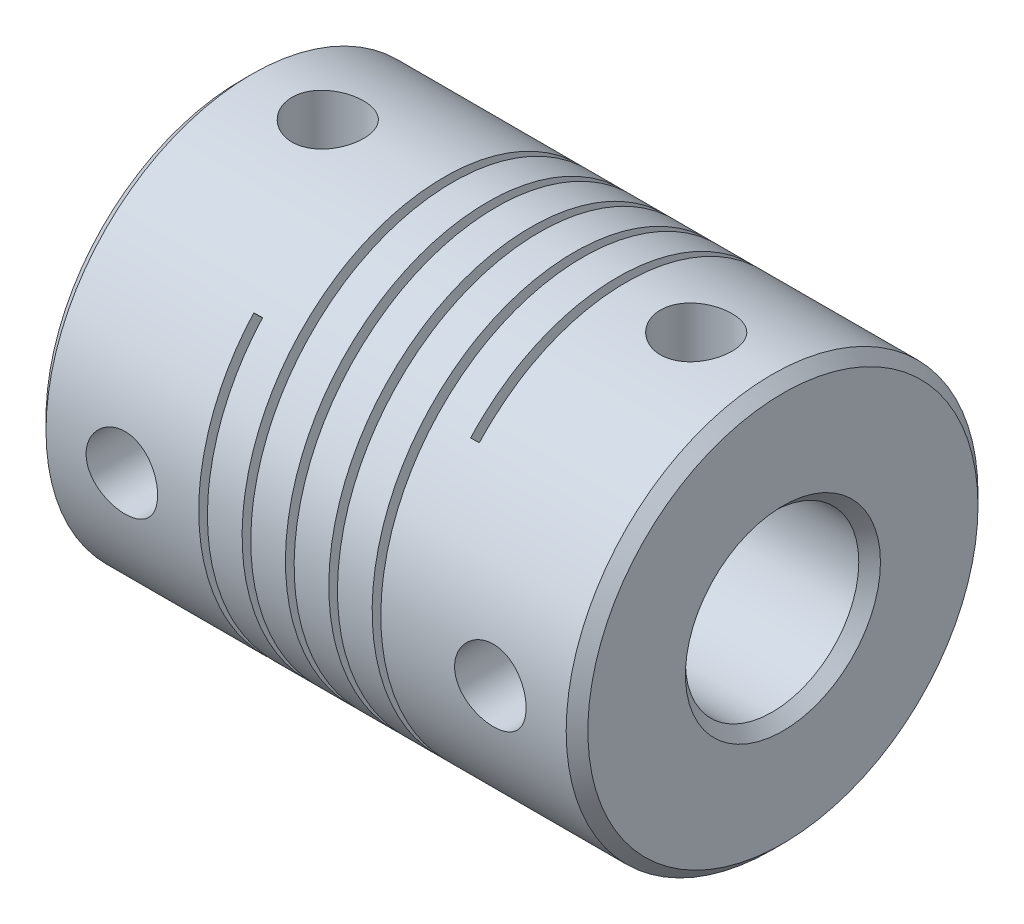
from build123d import *

# Parameters (mm, degrees)
SKETCH1_R                 = 9.5
BOSS_EXTRUDE1_DEPTH       = 25
SKETCH2_R                 = 2.5
CUT_EXTRUDE1_DEPTH        = 29.381331893
CUT_SWEEP1_PITCH          = 2
SKETCH7_R                 = 4
CUT_EXTRUDE2_DEPTH        = 12.5
SKETCH8_R                 = 1.65
CUT_EXTRUDE3_DEPTH        = 9
CIRPATTERN1_COUNT         = 2
CIRPATTERN1_ANGLE         = 90
LPATTERN1_COUNT           = 2
LPATTERN1_PITCH           = 17
LPATTERN1_COPY_1_SKETCH_R = 1.65
LPATTERN1_COPY_1_DEPTH    = 9
CHAMFER1_SIZE             = 0.5


with BuildPart() as part:
    # Sketch1 → Boss-Extrude1 (new body)
    with BuildSketch(Plane(origin=(0, 0, 0), x_dir=(0, 0, -1), z_dir=(1, 0, 0))):
        Circle(SKETCH1_R)
    extrude(amount=BOSS_EXTRUDE1_DEPTH)

    # Sketch2 → Cut-Extrude1 (cut, through all)
    with BuildSketch(Plane.ZY):
        Circle(SKETCH2_R)
    extrude(amount=-CUT_EXTRUDE1_DEPTH, mode=Mode.SUBTRACT)

    # Cut-Sweep1: the profile of Sketch6 profile screwed along a right-hand helix of 5 turns, 10 arcs to a turn; built about Z, then put on its axis
    cut_sweep1_z = Axis((0, 0, 0), (0, 0, 1))
    cut_sweep1_corners = [(9.5003, -0.000137108, 0.004092011), (9.500300002, -0.013532113, 0.403867665), (1.5, -0.013532113, 0.403867665), (1.5, -0.000137108, 0.004092011)]
    with BuildLine(mode=Mode.PRIVATE) as cut_sweep1_profile:
        Line(cut_sweep1_corners[0], cut_sweep1_corners[1])
        Line(cut_sweep1_corners[1], cut_sweep1_corners[2])
        Line(cut_sweep1_corners[2], cut_sweep1_corners[3])
        Line(cut_sweep1_corners[3], cut_sweep1_corners[0])
    cut_sweep1_cap = Face(cut_sweep1_profile.wire())
    cut_sweep1_turn_angles = [0, 18, 36, 54, 72, 90, 108, 126, 144, 162, 180, 198, 216, 234, 252, 270, 288, 306, 324, 342, 360]
    cut_sweep1_turn_weights = [1, 0.9510565162951535, 1, 0.9510565162951535, 1, 0.9510565162951535, 1, 0.9510565162951535, 1, 0.9510565162951535, 1, 0.9510565162951535, 1, 0.9510565162951535, 1, 0.9510565162951535, 1, 0.9510565162951535, 1, 0.9510565162951535, 1]
    cut_sweep1_turn_rails = [Edge.make_bspline([Vector(p[0], p[1], 0).rotate(cut_sweep1_z, cut_sweep1_turn_angles[k]) / cut_sweep1_turn_weights[k] + Vector(0, 0, p[2] + CUT_SWEEP1_PITCH * cut_sweep1_turn_angles[k] / 360) for k in range(21)], [0, 0, 0, 1, 1, 2, 2, 3, 3, 4, 4, 5, 5, 6, 6, 7, 7, 8, 8, 9, 9, 10, 10, 10], 2, cut_sweep1_turn_weights) for p in cut_sweep1_corners]
    cut_sweep1_turn_sides = [Face.make_surface_from_curves(cut_sweep1_turn_rails[p[0]], cut_sweep1_turn_rails[p[1]]) for p in [(0, 1), (1, 2), (2, 3), (3, 0)]]
    cut_sweep1 = Plane(origin=(7.3, 0, 0), x_dir=(0, 0.7071067811865488, 0.7071067811865464), z_dir=(1, 0, 0)) * Solid(Shell([*[p.moved(Location((0, 0, CUT_SWEEP1_PITCH * i))) for i in range(5) for p in cut_sweep1_turn_sides], cut_sweep1_cap, cut_sweep1_cap.rotate(cut_sweep1_z, 1800).moved(Location((0, 0, CUT_SWEEP1_PITCH * 1800 / 360)))]))
    add(cut_sweep1, mode=Mode.SUBTRACT)

    # Sketch7 → Cut-Extrude2 (cut)
    with BuildSketch(Plane(origin=(25, 0, 0), x_dir=(0, 0, -1), z_dir=(1, 0, 0))):
        Circle(SKETCH7_R)
    extrude(amount=-CUT_EXTRUDE2_DEPTH, mode=Mode.SUBTRACT)

    # Sketch8 → Cut-Extrude3 (cut)
    with BuildSketch(Plane(origin=(0, 9.5, 0), x_dir=(1, 0, 0), z_dir=(0, 1, 0))):
        with Locations(Location((4, 0, 0), (0, 0, 270))):
            Circle(SKETCH8_R)
    cut_extrude3 = extrude(amount=-CUT_EXTRUDE3_DEPTH, mode=Mode.SUBTRACT)

    # CirPattern1: Cut-Extrude3 ×2 about axis
    cirpattern1_axis = Axis((27.801511335, 0, 0), (1, 0, 0))
    for i in range(1, CIRPATTERN1_COUNT):
        add(cut_extrude3.rotate(cirpattern1_axis, i * CIRPATTERN1_ANGLE / (CIRPATTERN1_COUNT - 1)), mode=Mode.SUBTRACT)

    # LPattern1: Cut-Extrude3 ×2
    with Locations(*[(i * LPATTERN1_PITCH, 0, 0) for i in range(1, LPATTERN1_COUNT)]):
        add(cut_extrude3, mode=Mode.SUBTRACT)

    # LPattern1 copy 1 sketch → LPattern1 copy 1 (cut)
    with BuildSketch(Plane(origin=(17, 0, 9.5), x_dir=(1, 0, 0), z_dir=(0, 0, 1))):
        with Locations(Location((4, 0, 0), (0, 0, 270))):
            Circle(LPATTERN1_COPY_1_SKETCH_R)
    extrude(amount=-LPATTERN1_COPY_1_DEPTH, mode=Mode.SUBTRACT)

    # Chamfer1
    chamfer1_edges = [part.edges().sort_by_distance(p)[0] for p in [
        (0, 0, 9.5),
        (25, 0, 4),
        (25, 0, 9.5),
        (0, 0, -2.5),
    ]]
    chamfer(chamfer1_edges, length=CHAMFER1_SIZE)


solid = part.part
